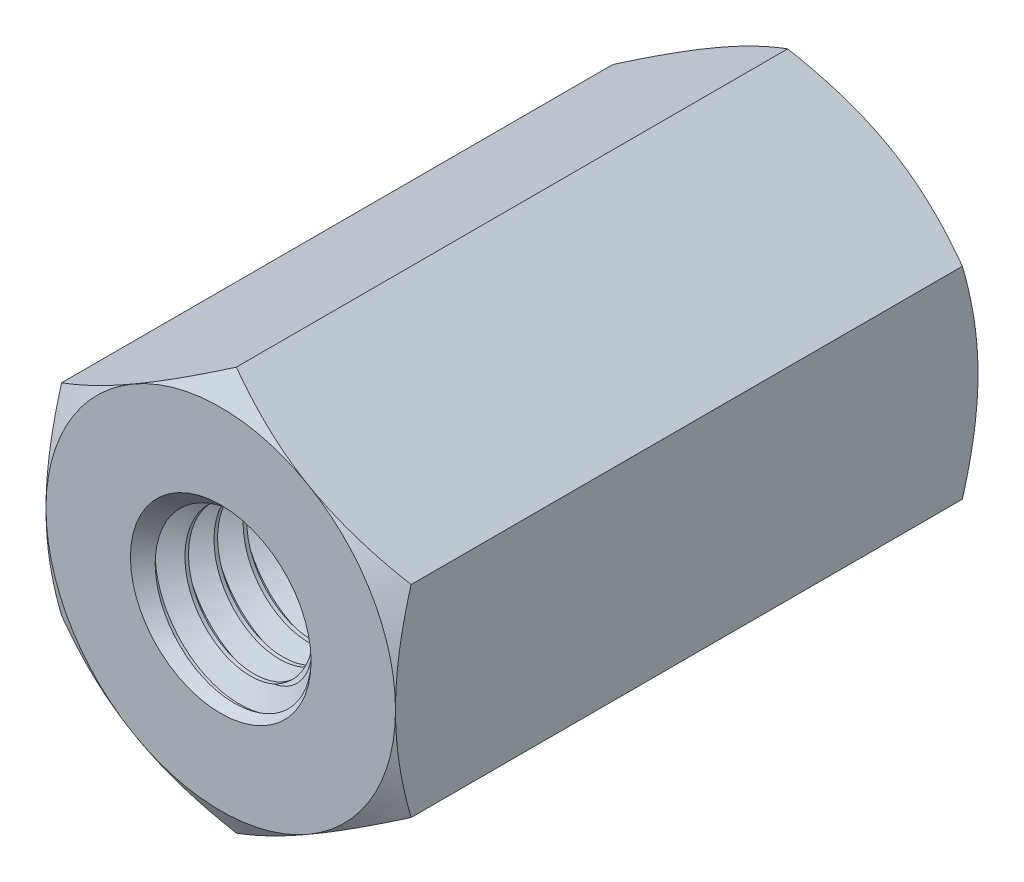
from build123d import *

# Parameters (mm, degrees)
EXTRUDE1_DEPTH          = 5
EXTRUDE1_DEPTH_BACK     = 5
SKETCH1_R               = 1.5
SWEEP1_PITCH            = 0.5
EXTRUDE2_DEPTH          = 12.456598131
SKETCH8_OUTSIDE_W       = 53.938
SKETCH8_OUTSIDE_H       = 54.866
SKETCH8_OUTSIDE_R       = 3
EXTRUDE4_DEPTH          = 12.456598131
EXTRUDE4_DRAFT          = -60
MIRROR1_COPY_1_SKETCH_W = 53.938
MIRROR1_COPY_1_SKETCH_H = 54.866
MIRROR1_COPY_1_SKETCH_R = 3
MIRROR1_COPY_1_DEPTH    = 12.456598131
MIRROR1_COPY_1_DRAFT    = -60


with BuildPart() as part:
    # Sketch1 → Extrude1 (new, two sides: drawn at the far end of the back side and taken through both)
    with BuildSketch(Plane.XY.offset(-EXTRUDE1_DEPTH_BACK)):
        Polygon((0, 3.464101615), (-3, 1.732050808), (-3, -1.732050808), (0, -3.464101615), (3, -1.732050808), (3, 1.732050808), align=None)
        Circle(SKETCH1_R, mode=Mode.SUBTRACT)
    extrude(amount=EXTRUDE1_DEPTH + EXTRUDE1_DEPTH_BACK)

    # Sweep1: the profile of Sketch12 profile screwed along a right-hand helix of 21 turns, 6 arcs to a turn; built about Z, then put on its axis
    sweep1_z = Axis((0, 0, 0), (0, 0, 1))
    sweep1_corners = [(1.5003, 0, -0.437673205), (1.5003, 0, 0.000173205), (1.175240474, 0, -0.1875), (1.175240474, 0, -0.25)]
    with BuildLine(mode=Mode.PRIVATE) as sweep1_profile:
        Line(sweep1_corners[0], sweep1_corners[1])
        Line(sweep1_corners[1], sweep1_corners[2])
        Line(sweep1_corners[2], sweep1_corners[3])
        Line(sweep1_corners[3], sweep1_corners[0])
    sweep1_cap = Face(sweep1_profile.wire())
    sweep1_turn_angles = [0, 30, 60, 90, 120, 150, 180, 210, 240, 270, 300, 330, 360]
    sweep1_turn_weights = [1, 0.8660254037844387, 1, 0.8660254037844387, 1, 0.8660254037844387, 1, 0.8660254037844387, 1, 0.8660254037844387, 1, 0.8660254037844387, 1]
    sweep1_turn_rails = [Edge.make_bspline([Vector(p[0], p[1], 0).rotate(sweep1_z, sweep1_turn_angles[k]) / sweep1_turn_weights[k] + Vector(0, 0, p[2] + SWEEP1_PITCH * sweep1_turn_angles[k] / 360) for k in range(13)], [0, 0, 0, 1, 1, 2, 2, 3, 3, 4, 4, 5, 5, 6, 6, 6], 2, sweep1_turn_weights) for p in sweep1_corners]
    sweep1_turn_sides = [Face.make_surface_from_curves(sweep1_turn_rails[p[0]], sweep1_turn_rails[p[1]]) for p in [(0, 1), (1, 2), (2, 3), (3, 0)]]
    sweep1 = Plane(origin=(0, 0, -5), x_dir=(0, 1, 0), z_dir=(0, 0, 1)) * Solid(Shell([*[p.moved(Location((0, 0, SWEEP1_PITCH * i))) for i in range(21) for p in sweep1_turn_sides], sweep1_cap, sweep1_cap.rotate(sweep1_z, 7560).moved(Location((0, 0, SWEEP1_PITCH * 7560 / 360)))]))
    add(sweep1)

    # Sketch6 → Extrude2 (cut, through all)
    with BuildSketch(Plane(origin=(0, 0, -5), x_dir=(-1, 0, 0), z_dir=(0, 0, -1))):
        Polygon((0, 3.464101615), (-3, 1.732050808), (-3, -1.732050808), (0, -3.464101615), (3, -1.732050808), (3, 1.732050808), align=None)
    extrude2 = extrude(amount=EXTRUDE2_DEPTH, mode=Mode.SUBTRACT)

    # Extrude3 cone 1 section (through the dimple's axis) → Extrude3 (revolve, cut)
    with BuildSketch(Plane(origin=(0, 0, -5), x_dir=(0, 1, 0), z_dir=(1, 0, 0))):
        Polygon((0, 0), (1.5508, 0), (0, 1.663029396), align=None)
    extrude3 = revolve(axis=Axis((0, 0, -5), (0, 0, 1)), mode=Mode.SUBTRACT)


with BuildPart() as extrude4_tool:
    # Sketch8 outside → Extrude4 (with draft: the straight prism first)
    with BuildSketch(Plane(origin=(0, 0, -5), x_dir=(-1, 0, 0), z_dir=(0, 0, -1))):
        Rectangle(SKETCH8_OUTSIDE_W, SKETCH8_OUTSIDE_H)
        Circle(SKETCH8_OUTSIDE_R, mode=Mode.SUBTRACT)
    extrude(amount=-EXTRUDE4_DEPTH)
    # Extrude4: the draft: its side faces are tilted about the plane it starts from
    extrude4_sides = [extrude4_tool.faces().sort_by_distance(p)[0] for p in [
        (0, -27.433, 1.228299065),
        (-26.969, 0, 1.228299065),
        (0, 27.433, 1.228299065),
        (26.969, 0, 1.228299065),
        (3, 0, 1.228299065),
    ]]
    draft(extrude4_sides, Plane(origin=(0, 0, -5), x_dir=(-1, 0, 0), z_dir=(0, 0, -1)), EXTRUDE4_DRAFT)


with BuildPart() as part_1:
    add(part.part)

    # Extrude4: cut by extrude4_tool
    add(extrude4_tool.part, mode=Mode.SUBTRACT)

    # Mirror1: Extrude2, Extrude3 across plane
    add(extrude2.mirror(Plane.XY), mode=Mode.SUBTRACT)
    add(extrude3.mirror(Plane.XY), mode=Mode.SUBTRACT)


with BuildPart() as mirror1_copy_1_tool:
    # Mirror1 copy 1 sketch → Mirror1 copy 1 (with draft: the straight prism first)
    with BuildSketch(Plane(origin=(0, 0, 5), x_dir=(-1, 0, 0), z_dir=(0, 0, 1))):
        Rectangle(MIRROR1_COPY_1_SKETCH_W, MIRROR1_COPY_1_SKETCH_H)
        Circle(MIRROR1_COPY_1_SKETCH_R, mode=Mode.SUBTRACT)
    extrude(amount=-MIRROR1_COPY_1_DEPTH)
    # Mirror1 copy 1: the draft: its side faces are tilted about the plane it starts from
    mirror1_copy_1_sides = [mirror1_copy_1_tool.faces().sort_by_distance(p)[0] for p in [
        (0, -27.433, -1.228299065),
        (-26.969, 0, -1.228299065),
        (0, 27.433, -1.228299065),
        (26.969, 0, -1.228299065),
        (3, 0, -1.228299065),
    ]]
    draft(mirror1_copy_1_sides, Plane(origin=(0, 0, 5), x_dir=(-1, 0, 0), z_dir=(0, 0, 1)), MIRROR1_COPY_1_DRAFT)


with BuildPart() as part_2:
    add(part_1.part)

    # Mirror1 copy 1: cut by mirror1_copy_1_tool
    add(mirror1_copy_1_tool.part, mode=Mode.SUBTRACT)


solid = part_2.part
